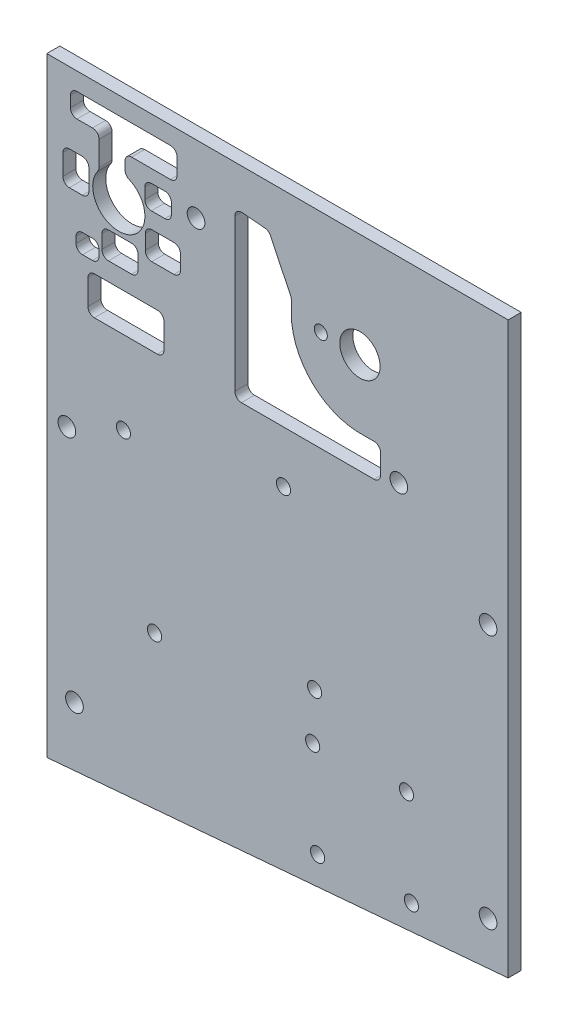
from build123d import *

# Parameters (mm, degrees)
BOSS_EXTRUDE1_DEPTH          = 3.175
F_6_CLEARANCE_HOLE1_D        = 4.3053
F_4_CLEARANCE_HOLE1_D        = 3.4544
F_6_CLEARANCE_HOLE2_D        = 4.3053
F_3_8_0_386_DIAMETER_HOLE1_D = 9.8044
F_1_8_0_125_DIAMETER_HOLE1_D = 3.175
F_1_2_0_5_DIAMETER_HOLE1_D   = 12.7
BACKLIGHTING_LED_HOLES_DEPTH = 187.058467544
THIN_SECTION_FILLET_R        = 1.5875


with BuildPart() as part:
    # Sketch1 → Boss-Extrude1 (new body)
    with BuildSketch(Plane.XY):
        Polygon((112.268, 0), (0, 0), (0, -148.336), (112.268, -138.684), align=None)
    extrude(amount=-BOSS_EXTRUDE1_DEPTH)

    # #6 Clearance Hole1 (through all)
    with Locations(Plane.XY):
        with Locations((6.731, -133.35), (107.3785, -128.5875), (107.3785, -66.675), (4.8895, -76.2)):
            Hole(F_6_CLEARANCE_HOLE1_D / 2)

    # #4 Clearance Hole1 (through all)
    with Locations(Plane.XY):
        with Locations((18.644469576, -70.03220158), (57.60279842, -62.459469576), (65.175530424, -101.41779842), (26.21720158, -108.990530424), (65.891864398, -135.837535562), (88.720535562, -134.641135602), (87.524135602, -111.812464438), (64.695464438, -113.008864398)):
            Hole(F_4_CLEARANCE_HOLE1_D / 2)

    # #6 Clearance Hole2 (through all)
    with Locations(Plane.XY):
        with Locations((36.322, -16.51), (85.6615, -47.625)):
            Hole(F_6_CLEARANCE_HOLE2_D / 2)

    # 3/8 (0.386) Diameter Hole1 (through all)
    with Locations(Plane.XY):
        with Locations((76.2, -25.4)):
            Hole(F_3_8_0_386_DIAMETER_HOLE1_D / 2)

    # 1/8 (0.125) Diameter Hole1 (through all)
    with Locations(Plane.XY):
        with Locations((66.675, -25.4)):
            Hole(F_1_8_0_125_DIAMETER_HOLE1_D / 2)

    # 1/2 (0.5) Diameter Hole1 (through all)
    with Locations(Plane.XY):
        with Locations((17.526, -22.352)):
            Hole(F_1_2_0_5_DIAMETER_HOLE1_D / 2)

    # Sketch15 → Backlighting LED Holes (cut, through all)
    with BuildSketch(Plane.XY):
        with BuildLine():
            Line((7.339054857, -4.328361061), (30.0964015, -4.328361061))
            ThreePointArc((30.0964015, -4.328361061), (31.218933515, -4.793329045), (31.6839015, -5.915861061))
            Line((31.6839015, -5.915861061), (31.6839015, -9.908235776))
            ThreePointArc((31.6839015, -9.908235776), (31.218933515, -11.030767791), (30.0964015, -11.495735776))
            Line((30.0964015, -11.495735776), (20.631011428, -11.495735776))
            ThreePointArc((20.631011428, -11.495735776), (19.508479413, -11.960703761), (19.043511428, -13.083235776))
            Line((19.043511428, -13.083235776), (19.043511428, -18.524524545))
            ThreePointArc((19.043511428, -18.524524545), (18.578543443, -19.64705656), (17.456011428, -20.112024545))
            Line((17.456011428, -20.112024545), (14.310816392, -20.112024545))
            ThreePointArc((14.310816392, -20.112024545), (13.188284377, -19.64705656), (12.723316392, -18.524524545))
            Line((12.723316392, -18.524524545), (12.723316392, -11.714802898))
            ThreePointArc((12.723316392, -11.714802898), (12.258348407, -10.592270883), (11.135816392, -10.127302898))
            Line((11.135816392, -10.127302898), (7.339054857, -10.127302898))
            ThreePointArc((7.339054857, -10.127302898), (6.216522842, -9.662334913), (5.751554857, -8.539802898))
            Line((5.751554857, -8.539802898), (5.751554857, -5.915861061))
            ThreePointArc((5.751554857, -5.915861061), (6.216522842, -4.793329045), (7.339054857, -4.328361061))
        make_face()
        with BuildLine():
            Line((45.76684628, -11.334409696), (45.76684628, -48.305263367))
            ThreePointArc((45.76684628, -48.305263367), (46.231814265, -49.427795383), (47.35434628, -49.892763367))
            Line((47.35434628, -49.892763367), (79.636793595, -49.892763367))
            ThreePointArc((79.636793595, -49.892763367), (80.75932561, -49.427795383), (81.224293595, -48.305263367))
            Line((81.224293595, -48.305263367), (81.224293595, -43.493410806))
            ThreePointArc((81.224293595, -43.493410806), (80.75932561, -42.370878791), (79.636793595, -41.905910806))
            Line((79.636793595, -41.905910806), (75.563199989, -41.905910806))
            ThreePointArc((75.563199989, -41.905910806), (64.154016446, -36.686971822), (59.493474164, -25.03853249))
            Line((59.493474164, -25.03853249), (59.493474164, -22.059087276))
            ThreePointArc((59.493474164, -22.059087276), (59.453672194, -21.705835159), (59.336262122, -21.370296591))
            Line((59.336262122, -21.370296591), (54.40794388, -11.136542869))
            ThreePointArc((54.40794388, -11.136542869), (53.879963689, -10.519195374), (53.115722051, -10.24384881))
            Line((53.115722051, -10.24384881), (47.492412409, -9.752924952))
            ThreePointArc((47.492412409, -9.752924952), (46.281738181, -10.164081488), (45.76684628, -11.334409696))
        make_face()
        with BuildLine():
            Line((25.433540081, -14.636226942), (28.726512083, -14.636226942))
            ThreePointArc((28.726512083, -14.636226942), (29.849044098, -15.101194927), (30.314012083, -16.223726942))
            Line((30.314012083, -16.223726942), (30.314012083, -18.836777358))
            ThreePointArc((30.314012083, -18.836777358), (29.849044098, -19.959309374), (28.726512083, -20.424277358))
            Line((28.726512083, -20.424277358), (25.433540081, -20.424277358))
            ThreePointArc((25.433540081, -20.424277358), (24.311008066, -19.959309374), (23.846040081, -18.836777358))
            Line((23.846040081, -18.836777358), (23.846040081, -16.223726942))
            ThreePointArc((23.846040081, -16.223726942), (24.311008066, -15.101194927), (25.433540081, -14.636226942))
        make_face()
        with BuildLine():
            Line((25.548296898, -24.345195333), (30.931979755, -24.345195333))
            ThreePointArc((30.931979755, -24.345195333), (32.05451177, -24.810163317), (32.519479755, -25.932695333))
            Line((32.519479755, -25.932695333), (32.519479755, -29.489024329))
            ThreePointArc((32.519479755, -29.489024329), (32.05451177, -30.611556344), (30.931979755, -31.076524329))
            Line((30.931979755, -31.076524329), (25.548296898, -31.076524329))
            ThreePointArc((25.548296898, -31.076524329), (24.425764883, -30.611556344), (23.960796898, -29.489024329))
            Line((23.960796898, -29.489024329), (23.960796898, -25.932695333))
            ThreePointArc((23.960796898, -25.932695333), (24.425764883, -24.810163317), (25.548296898, -24.345195333))
        make_face()
        with BuildLine():
            Line((14.997904345, -29.660667432), (20.633094605, -29.660667432))
            ThreePointArc((20.633094605, -29.660667432), (21.755626621, -30.125635417), (22.220594605, -31.248167432))
            Line((22.220594605, -31.248167432), (22.220594605, -34.595023868))
            ThreePointArc((22.220594605, -34.595023868), (21.755626621, -35.717555883), (20.633094605, -36.182523868))
            Line((20.633094605, -36.182523868), (14.997904345, -36.182523868))
            ThreePointArc((14.997904345, -36.182523868), (13.875372329, -35.717555883), (13.410404345, -34.595023868))
            Line((13.410404345, -34.595023868), (13.410404345, -31.248167432))
            ThreePointArc((13.410404345, -31.248167432), (13.875372329, -30.125635417), (14.997904345, -29.660667432))
        make_face()
        with BuildLine():
            Line((5.50446049, -17.336640746), (8.639433569, -17.336640746))
            ThreePointArc((8.639433569, -17.336640746), (9.761965585, -17.801608731), (10.226933569, -18.924140746))
            Line((10.226933569, -18.924140746), (10.226933569, -23.936953348))
            ThreePointArc((10.226933569, -23.936953348), (9.761965585, -25.059485363), (8.639433569, -25.524453348))
            Line((8.639433569, -25.524453348), (5.50446049, -25.524453348))
            ThreePointArc((5.50446049, -25.524453348), (4.381928475, -25.059485363), (3.91696049, -23.936953348))
            Line((3.91696049, -23.936953348), (3.91696049, -18.924140746))
            ThreePointArc((3.91696049, -18.924140746), (4.381928475, -17.801608731), (5.50446049, -17.336640746))
        make_face()
        with BuildLine():
            Line((8.699390862, -33.375423291), (11.109272906, -33.375423291))
            ThreePointArc((11.109272906, -33.375423291), (12.231804921, -33.840391276), (12.696772906, -34.962923291))
            Line((12.696772906, -34.962923291), (12.696772906, -36.45936603))
            ThreePointArc((12.696772906, -36.45936603), (12.231804921, -37.581898045), (11.109272906, -38.04686603))
            Line((11.109272906, -38.04686603), (8.699390862, -38.04686603))
            ThreePointArc((8.699390862, -38.04686603), (7.576858846, -37.581898045), (7.111890862, -36.45936603))
            Line((7.111890862, -36.45936603), (7.111890862, -34.962923291))
            ThreePointArc((7.111890862, -34.962923291), (7.576858846, -33.840391276), (8.699390862, -33.375423291))
        make_face()
        with BuildLine():
            Line((11.585805265, -40.623771356), (26.916605288, -40.623771356))
            ThreePointArc((26.916605288, -40.623771356), (28.039137303, -41.088739341), (28.504105288, -42.211271356))
            Line((28.504105288, -42.211271356), (28.504105288, -48.305263367))
            ThreePointArc((28.504105288, -48.305263367), (28.039137303, -49.427795383), (26.916605288, -49.892763367))
            Line((26.916605288, -49.892763367), (11.585805265, -49.892763367))
            ThreePointArc((11.585805265, -49.892763367), (10.46327325, -49.427795383), (9.998305265, -48.305263367))
            Line((9.998305265, -48.305263367), (9.998305265, -42.211271356))
            ThreePointArc((9.998305265, -42.211271356), (10.46327325, -41.088739341), (11.585805265, -40.623771356))
        make_face()
    extrude(amount=-BACKLIGHTING_LED_HOLES_DEPTH, mode=Mode.SUBTRACT)

    # Thin Section Fillet
    thin_section_fillet_edges = [part.edges().sort_by_distance(p)[0] for p in [
        (19.043511428, -16.185991642, -1.5875),
        (12.723316392, -18.197877932, -1.5875),
    ]]
    fillet(thin_section_fillet_edges, radius=THIN_SECTION_FILLET_R)


solid = part.part
